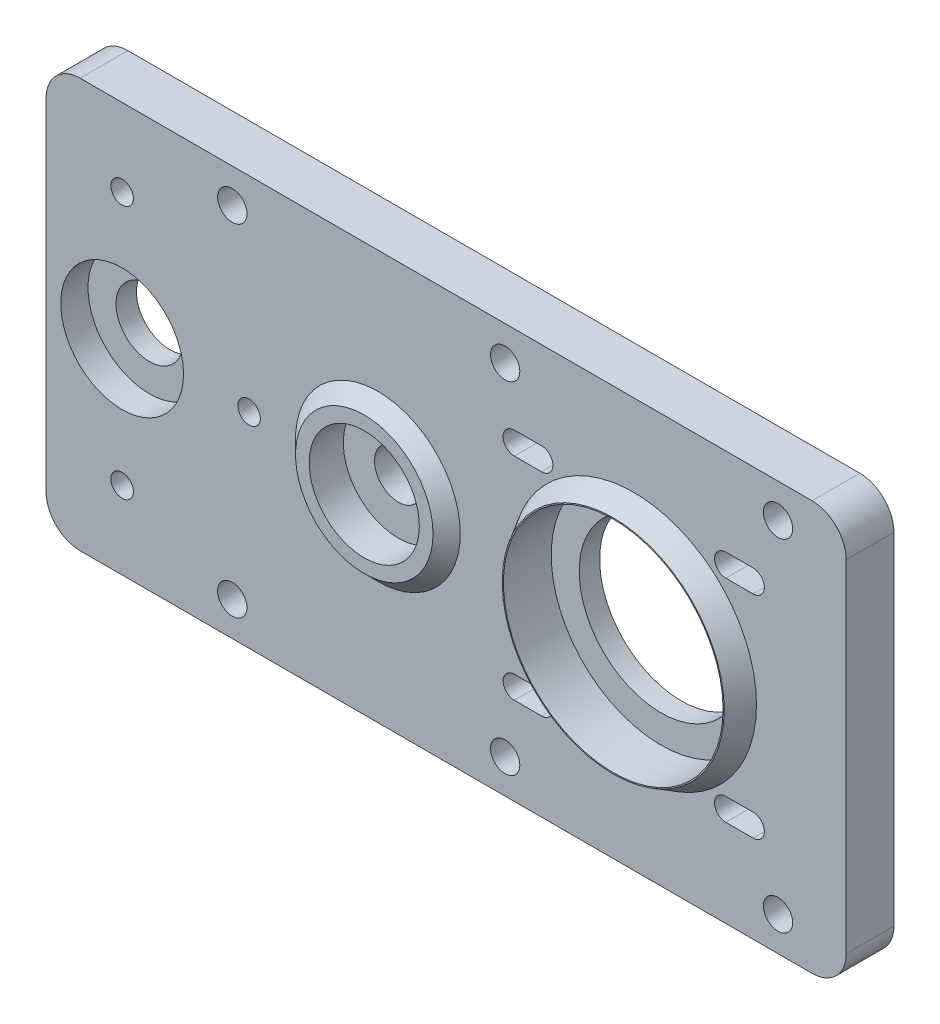
from build123d import *

# Parameters (mm, degrees)
SKETCH1_W           = 100
SKETCH1_H           = 60
SKETCH1_R           = 12
BOSS_EXTRUDE1_DEPTH = 7
SKETCH4_R           = 8.075
CUT_EXTRUDE1_DEPTH  = 3
SKETCH5_R           = 3.5
CUT_EXTRUDE2_DEPTH  = 5
EXTRUDE_THIN1_START = 2
SKETCH6_R           = 10.075
SKETCH6_R_2         = 8.075
EXTRUDE_THIN1_DEPTH = 2
CHAMFER1_SIZE       = 2
SKETCH7_R           = 2.15
CUT_EXTRUDE3_DEPTH  = 85.654134571
FILLET1_R           = 5
CUT_EXTRUDE4_DEPTH  = 3
SKETCH9_R           = 16.1
CUT_EXTRUDE5_DEPTH  = 4
BOSS_EXTRUDE2_START = 3
SKETCH10_R          = 18
SKETCH10_R_2        = 16.1
BOSS_EXTRUDE2_DEPTH = 3
CHAMFER2_SIZE2      = 3
CHAMFER2_SIZE       = 1.732050808
SKETCH11_W          = 22.3
SKETCH11_H          = 60
SKETCH11_R          = 4.9
BOSS_EXTRUDE3_DEPTH = 7
FILLET2_R           = 5
SKETCH12_R          = 9
CUT_EXTRUDE6_DEPTH  = 4
SKETCH15_R          = 1.65
CUT_EXTRUDE7_DEPTH  = 10


with BuildPart() as part:
    # Sketch1 → Boss-Extrude1 (new body)
    with BuildSketch(Plane.XY):
        with Locations((-28.85, 0)):
            Rectangle(SKETCH1_W, SKETCH1_H)
        with Locations((-10, 0)):
            Circle(SKETCH1_R, mode=Mode.SUBTRACT)
        with BuildLine():
            Line((3.5, 13.85), (7.5, 13.85))
            ThreePointArc((7.5, 13.85), (9.15, 15.5), (7.5, 17.15))
            Line((7.5, 17.15), (3.5, 17.15))
            ThreePointArc((3.5, 17.15), (1.85, 15.5), (3.5, 13.85))
        make_face(mode=Mode.SUBTRACT)
        with BuildLine():
            Line((-27.5, 17.15), (-23.5, 17.15))
            ThreePointArc((-23.5, 17.15), (-21.85, 15.5), (-23.5, 13.85))
            Line((-23.5, 13.85), (-27.5, 13.85))
            ThreePointArc((-27.5, 13.85), (-29.15, 15.5), (-27.5, 17.15))
        make_face(mode=Mode.SUBTRACT)
        with BuildLine():
            Line((3.5, -17.15), (7.5, -17.15))
            ThreePointArc((7.5, -17.15), (9.15, -15.5), (7.5, -13.85))
            Line((7.5, -13.85), (3.5, -13.85))
            ThreePointArc((3.5, -13.85), (1.85, -15.5), (3.5, -17.15))
        make_face(mode=Mode.SUBTRACT)
        with BuildLine():
            Line((-27.5, -17.15), (-23.5, -17.15))
            ThreePointArc((-23.5, -17.15), (-21.85, -15.5), (-23.5, -13.85))
            Line((-23.5, -13.85), (-27.5, -13.85))
            ThreePointArc((-27.5, -13.85), (-29.15, -15.5), (-27.5, -17.15))
        make_face(mode=Mode.SUBTRACT)
    extrude(amount=BOSS_EXTRUDE1_DEPTH)

    # Sketch4 → Cut-Extrude1 (cut)
    with BuildSketch(Plane.XY.offset(7)):
        with Locations((-47.5, 0)):
            Circle(SKETCH4_R)
    extrude(amount=-CUT_EXTRUDE1_DEPTH, mode=Mode.SUBTRACT)

    # Sketch5 → Cut-Extrude2 (cut)
    with BuildSketch(Plane.XY.offset(4)):
        with Locations((-47.5, 0)):
            Circle(SKETCH5_R)
    extrude(amount=-CUT_EXTRUDE2_DEPTH, mode=Mode.SUBTRACT)

    # Sketch6 → Extrude-Thin1 (add)
    with BuildSketch(Plane.XY.offset(7).offset(EXTRUDE_THIN1_START)):
        with Locations((-47.5, 0)):
            Circle(SKETCH6_R)
        with Locations((-47.5, 0)):
            Circle(SKETCH6_R_2, mode=Mode.SUBTRACT)
    extrude(amount=-EXTRUDE_THIN1_DEPTH)

    # Chamfer1
    chamfer1_edges = [part.edges().sort_by_distance(p)[0] for p in [
        (-57.575, 0, 7),
    ]]
    chamfer(chamfer1_edges, length=CHAMFER1_SIZE - 0.0001)  # a hair under: the kernel refuses the full size

    # Sketch7 → Cut-Extrude3 (cut, through all)
    with BuildSketch(Plane.XY.offset(7)):
        with Locations((-68.85, 25)):
            Circle(SKETCH7_R)
        with Locations((-28.85, 25)):
            Circle(SKETCH7_R)
        with Locations((11.15, 25)):
            Circle(SKETCH7_R)
        with Locations((11.15, -25)):
            Circle(SKETCH7_R)
        with Locations((-28.85, -25)):
            Circle(SKETCH7_R)
        with Locations((-68.85, -25)):
            Circle(SKETCH7_R)
    extrude(amount=-CUT_EXTRUDE3_DEPTH, mode=Mode.SUBTRACT)

    # Fillet1
    fillet1_edges = [part.edges().sort_by_distance(p)[0] for p in [
        (21.15, -30, 3.5),
        (-78.85, -30, 3.5),
        (-78.85, 30, 3.5),
        (21.15, 30, 3.5),
    ]]
    fillet(fillet1_edges, radius=FILLET1_R)

    # Sketch8 → Cut-Extrude4 (cut)
    with BuildSketch(Plane(origin=(0, 0, 0), x_dir=(-1, 0, 0), z_dir=(0, 0, -1))):
        Polygon((-9.273611625, 28.25), (-13.026388375, 28.25), (-14.90277675, 25), (-13.026388375, 21.75), (-9.273611625, 21.75), (-7.39722325, 25), align=None)
        Polygon((26.973611625, 21.75), (30.726388375, 21.75), (32.60277675, 25), (30.726388375, 28.25), (26.973611625, 28.25), (25.09722325, 25), align=None)
        Polygon((70.726388375, 21.75), (72.60277675, 25), (70.726388375, 28.25), (66.973611625, 28.25), (65.09722325, 25), (66.973611625, 21.75), align=None)
        Polygon((66.973611625, -28.25), (70.726388375, -28.25), (72.60277675, -25), (70.726388375, -21.75), (66.973611625, -21.75), (65.09722325, -25), align=None)
        Polygon((32.60277675, -25), (30.726388375, -21.75), (26.973611625, -21.75), (25.09722325, -25), (26.973611625, -28.25), (30.726388375, -28.25), align=None)
        Polygon((-7.39722325, -25), (-9.273611625, -21.75), (-13.026388375, -21.75), (-14.90277675, -25), (-13.026388375, -28.25), (-9.273611625, -28.25), align=None)
    extrude(amount=-CUT_EXTRUDE4_DEPTH, mode=Mode.SUBTRACT)

    # Sketch9 → Cut-Extrude5 (cut)
    with BuildSketch(Plane.XY.offset(7)):
        with Locations((-10, 0)):
            Circle(SKETCH9_R)
    extrude(amount=-CUT_EXTRUDE5_DEPTH, mode=Mode.SUBTRACT)

    # Sketch10 → Boss-Extrude2 (add)
    with BuildSketch(Plane.XY.offset(7).offset(BOSS_EXTRUDE2_START)):
        with Locations((-10, 0)):
            Circle(SKETCH10_R)
        with Locations((-10, 0)):
            Circle(SKETCH10_R_2, mode=Mode.SUBTRACT)
    extrude(amount=-BOSS_EXTRUDE2_DEPTH)

    # Chamfer2
    chamfer2_edges = [part.edges().sort_by_distance(p)[0] for p in [
        (-28, 0, 10),
    ]]
    chamfer2_side = [part.faces().sort_by_distance(p)[0] for p in [
        (-27.965358984, 0, 10),
    ]]
    chamfer(chamfer2_edges, length=CHAMFER2_SIZE - 0.0001, length2=CHAMFER2_SIZE2 - 0.0001, reference=chamfer2_side[0])  # a hair under: the kernel refuses the full size

    # Sketch11 → Boss-Extrude3 (add)
    with BuildSketch(Plane(origin=(0, 0, 0), x_dir=(-1, 0, 0), z_dir=(0, 0, -1))):
        with Locations((85, 0)):
            Rectangle(SKETCH11_W, SKETCH11_H)
        with Locations((85, 0)):
            Circle(SKETCH11_R, mode=Mode.SUBTRACT)
    extrude(amount=-BOSS_EXTRUDE3_DEPTH)

    # Fillet2
    fillet2_edges = [part.edges().sort_by_distance(p)[0] for p in [
        (-96.15, 30, 3.5),
        (-96.15, -30, 3.5),
    ]]
    fillet(fillet2_edges, radius=FILLET2_R)

    # Sketch12 → Cut-Extrude6 (cut)
    with BuildSketch(Plane.XY.offset(7)):
        with Locations((-85, 0)):
            Circle(SKETCH12_R)
    extrude(amount=-CUT_EXTRUDE6_DEPTH, mode=Mode.SUBTRACT)

    # Sketch15 → Cut-Extrude7 (cut)
    with BuildSketch(Plane(origin=(0, 0, 0), x_dir=(-1, 0, 0), z_dir=(0, 0, -1))):
        with Locations((85, 18.61)):
            Circle(SKETCH15_R)
        with Locations((85, -18.61)):
            Circle(SKETCH15_R)
        with Locations((66.39, 0)):
            Circle(SKETCH15_R)
    extrude(amount=-CUT_EXTRUDE7_DEPTH, mode=Mode.SUBTRACT)


solid = part.part
